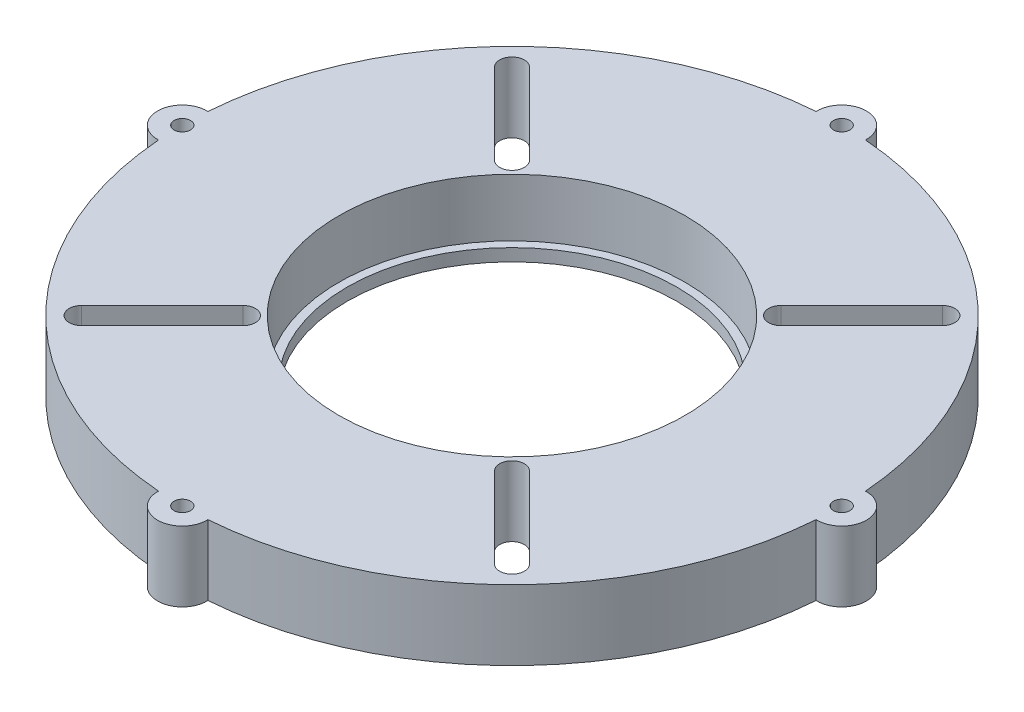
from build123d import *

# Parameters (mm, degrees)
SKETCH1_R           = 40
SKETCH1_R_2         = 20
BOSS_EXTRUDE1_DEPTH = 8.5
SKETCH2_R           = 1
CUT_EXTRUDE2_DEPTH  = 58.203583804
SKETCH2_6_R         = 3
SKETCH2_6_R_2       = 1
BOSS_EXTRUDE3_DEPTH = 8.5
CIRPATTERN1_COUNT   = 4
CUT_EXTRUDE4_DEPTH  = 62.402361518
CIRPATTERN3_COUNT   = 4
SKETCH7_R           = 21
CUT_EXTRUDE5_DEPTH  = 7


with BuildPart() as part:
    # Sketch1 → Boss-Extrude1 (new body)
    with BuildSketch(Plane(origin=(0, 0, 0), x_dir=(1, 0, 0), z_dir=(0, 1, 0))):
        Circle(SKETCH1_R)
        Circle(SKETCH1_R_2, mode=Mode.SUBTRACT)
    extrude(amount=BOSS_EXTRUDE1_DEPTH)

    # Sketch2 → Cut-Extrude2 (cut, through all)
    with BuildSketch(Plane(origin=(0, 8.5, 0), x_dir=(1, 0, 0), z_dir=(0, 1, 0))):
        with Locations((40, 0)):
            Circle(SKETCH2_R)
    cut_extrude2 = extrude(amount=-CUT_EXTRUDE2_DEPTH, mode=Mode.SUBTRACT)

    # Sketch2<6> → Boss-Extrude3 (add)
    with BuildSketch(Plane(origin=(0, 8.5, 0), x_dir=(1, 0, 0), z_dir=(0, 1, 0))):
        with Locations((40, 0)):
            Circle(SKETCH2_6_R)
        with Locations((40, 0)):
            Circle(SKETCH2_6_R_2, mode=Mode.SUBTRACT)
    boss_extrude3 = extrude(amount=-BOSS_EXTRUDE3_DEPTH)

    # CirPattern1: Cut-Extrude2, Boss-Extrude3 ×4 about axis
    cirpattern1_axis = Axis((0, 8.5, 0), (0, 1, 0))
    add([cut_extrude2.rotate(cirpattern1_axis, i * 360 / CIRPATTERN1_COUNT) for i in range(1, CIRPATTERN1_COUNT)], mode=Mode.SUBTRACT)
    add([boss_extrude3.rotate(cirpattern1_axis, i * 360 / CIRPATTERN1_COUNT) for i in range(1, CIRPATTERN1_COUNT)])

    # Sketch4 → Cut-Extrude4 (cut, through all)
    with BuildSketch(Plane(origin=(0, 8.5, 0), x_dir=(1, 0, 0), z_dir=(0, 1, 0))):
        with BuildLine():
            Line((-27.170578067, -25.049257724), (-17.377149148, -15.255828804))
            ThreePointArc((-17.377149148, -15.255828804), (-15.255828804, -15.255828804), (-15.255828804, -17.377149148))
            Line((-15.255828804, -17.377149148), (-25.049257724, -27.170578067))
            ThreePointArc((-25.049257724, -27.170578067), (-27.170578067, -27.170578067), (-27.170578067, -25.049257724))
        make_face()
    cut_extrude4 = extrude(amount=-CUT_EXTRUDE4_DEPTH, mode=Mode.SUBTRACT)

    # CirPattern3: Cut-Extrude4 ×4 about axis
    cirpattern3_axis = Axis((0, 8.5, 0), (0, 1, 0))
    for i in range(1, CIRPATTERN3_COUNT):
        add(cut_extrude4.rotate(cirpattern3_axis, i * 360 / CIRPATTERN3_COUNT), mode=Mode.SUBTRACT)

    # Sketch7 → Cut-Extrude5 (cut)
    with BuildSketch(Plane(origin=(0, 8.5, 0), x_dir=(1, 0, 0), z_dir=(0, 1, 0))):
        Circle(SKETCH7_R)
    extrude(amount=-CUT_EXTRUDE5_DEPTH, mode=Mode.SUBTRACT)


solid = part.part
